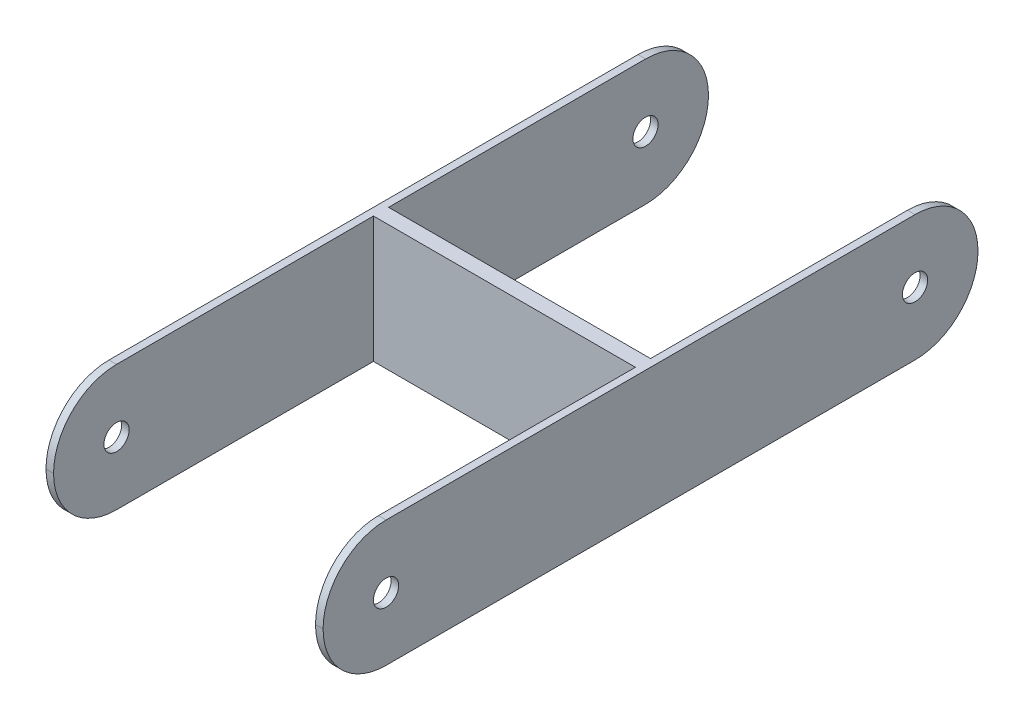
from build123d import *

# Parameters (mm, degrees)
BOSS_EXTRUDE1_DEPTH  = 12.5
FILLET1_R            = 12.5
SKETCH2_R            = 2.5
CUT_EXTRUDE1_DEPTH   = 45.370598373
FILLET1_OF_MIRROR1_R = 12.5


with BuildPart() as part:
    # Sketch1 → Boss-Extrude1 (new, symmetric)
    with BuildSketch(Plane(origin=(0, 0, 0), x_dir=(1, 0, 0), z_dir=(0, 1, 0))):
        Polygon((26, -31), (26, 32.5), (27.5, 32.5), (27.5, -32.5), (-27.5, -32.5), (-27.5, 32.5), (-26, 32.5), (-26, -31), align=None)
    boss_extrude1 = extrude(amount=BOSS_EXTRUDE1_DEPTH, both=True)

    # Fillet1
    fillet1_edges = [part.edges().sort_by_distance(p)[0] for p in [
        (-26.75, -12.5, -32.5),
        (-26.75, 12.5, -32.5),
        (26.75, -12.5, -32.5),
        (26.75, 12.5, -32.5),
    ]]
    fillet(fillet1_edges, radius=FILLET1_R - 0.0001)  # a hair under: the kernel refuses the full size

    # Sketch2 → Cut-Extrude1 (cut, symmetric)
    with BuildSketch(Plane(origin=(0, 0, 0), x_dir=(0, 0, -1), z_dir=(1, 0, 0))):
        with Locations((20, 0)):
            Circle(SKETCH2_R)
    cut_extrude1 = extrude(amount=CUT_EXTRUDE1_DEPTH, both=True, mode=Mode.SUBTRACT)

    # Mirror1: Boss-Extrude1, Cut-Extrude1 across plane
    add(boss_extrude1.mirror(Plane(origin=(27.5, 12.5, 32.5), x_dir=(1, 0, 0), z_dir=(0, 0, -1))))
    add(cut_extrude1.mirror(Plane(origin=(27.5, 12.5, 32.5), x_dir=(1, 0, 0), z_dir=(0, 0, -1))), mode=Mode.SUBTRACT)

    # Fillet1 of Mirror1
    fillet1_of_mirror1_edges = [part.edges().sort_by_distance(p)[0] for p in [
        (-26.75, -12.5, 97.5),
        (-26.75, 12.5, 97.5),
        (26.75, -12.5, 97.5),
        (26.75, 12.5, 97.5),
    ]]
    fillet(fillet1_of_mirror1_edges, radius=FILLET1_OF_MIRROR1_R - 0.0001)  # a hair under: the kernel refuses the full size


solid = part.part
